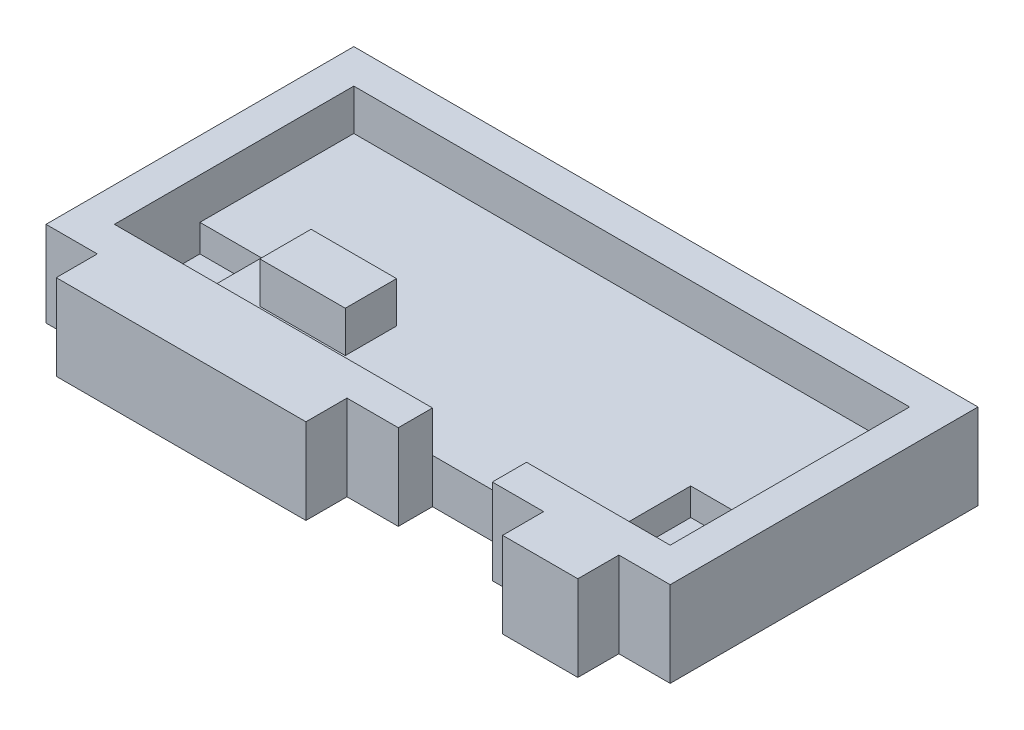
from build123d import *

# Parameters (mm, degrees)
SKETCH1_W           = 36.5
SKETCH1_H           = 18
BOSS_EXTRUDE1_DEPTH = 5
SKETCH2_W           = 32.5
SKETCH2_H           = 14
CUT_EXTRUDE1_DEPTH  = 2.4
SKETCH3_W           = 5
SKETCH3_H           = 3
BOSS_EXTRUDE2_DEPTH = 2.4
CUT_EXTRUDE2_REACH  = 42.165
SKETCH4_W           = 5.5
SKETCH4_H           = 5
SKETCH5_W           = 3.6
SKETCH5_H           = 5
SKETCH5_W_2         = 4.8
SKETCH5_H_2         = 6
CUT_EXTRUDE3_DEPTH  = 1.6
SKETCH6_W           = 14.6
SKETCH6_H           = 5
SKETCH6_W_2         = 4.4
BOSS_EXTRUDE3_DEPTH = 2.4


with BuildPart() as part:
    # Sketch1 → Boss-Extrude1 (new body)
    with BuildSketch(Plane(origin=(0, 0, 0), x_dir=(1, 0, 0), z_dir=(0, 1, 0))):
        with Locations((18.25, 9)):
            Rectangle(SKETCH1_W, SKETCH1_H)
    extrude(amount=-BOSS_EXTRUDE1_DEPTH)

    # Sketch2 → Cut-Extrude1 (cut)
    with BuildSketch(Plane(origin=(0, 0, 0), x_dir=(1, 0, 0), z_dir=(0, 1, 0))):
        with Locations((18.25, 9)):
            Rectangle(SKETCH2_W, SKETCH2_H)
    extrude(amount=-CUT_EXTRUDE1_DEPTH, mode=Mode.SUBTRACT)

    # Sketch3 → Boss-Extrude2 (add)
    with BuildSketch(Plane(origin=(0, -2.4, 0), x_dir=(1, 0, 0), z_dir=(0, 1, 0))):
        with Locations((10.5, 6)):
            Rectangle(SKETCH3_W, SKETCH3_H)
    extrude(amount=BOSS_EXTRUDE2_DEPTH)

    # Sketch4 → Cut-Extrude2 (cut, up to next)
    with BuildSketch(Plane(origin=(0, 0, -2), x_dir=(-1, 0, 0), z_dir=(0, 0, -1)), mode=Mode.PRIVATE) as cut_extrude2_sk1:
        with Locations((-23.35, -2.5)):
            Rectangle(SKETCH4_W, SKETCH4_H)
    cut_extrude2_tool1 = extrude(cut_extrude2_sk1.sketch, amount=-CUT_EXTRUDE2_REACH, mode=Mode.PRIVATE) & part.part
    add(cut_extrude2_tool1.solids().sort_by_distance((23.35, -2.5, -2))[0], mode=Mode.SUBTRACT)

    # Sketch5 → Cut-Extrude3 (cut)
    with BuildSketch(Plane(origin=(0, -2.4, 0), x_dir=(1, 0, 0), z_dir=(0, 1, 0))):
        with Locations((3.8, 4.5)):
            Rectangle(SKETCH5_W, SKETCH5_H)
        with Locations((32.1, 5)):
            Rectangle(SKETCH5_W_2, SKETCH5_H_2)
    extrude(amount=-CUT_EXTRUDE3_DEPTH, mode=Mode.SUBTRACT)

    # Sketch6 → Boss-Extrude3 (add)
    with BuildSketch(Plane.XY):
        with Locations((10.3, -2.5)):
            Rectangle(SKETCH6_W, SKETCH6_H)
        with Locations((31.3, -2.5)):
            Rectangle(SKETCH6_W_2, SKETCH6_H)
    extrude(amount=BOSS_EXTRUDE3_DEPTH)


solid = part.part
